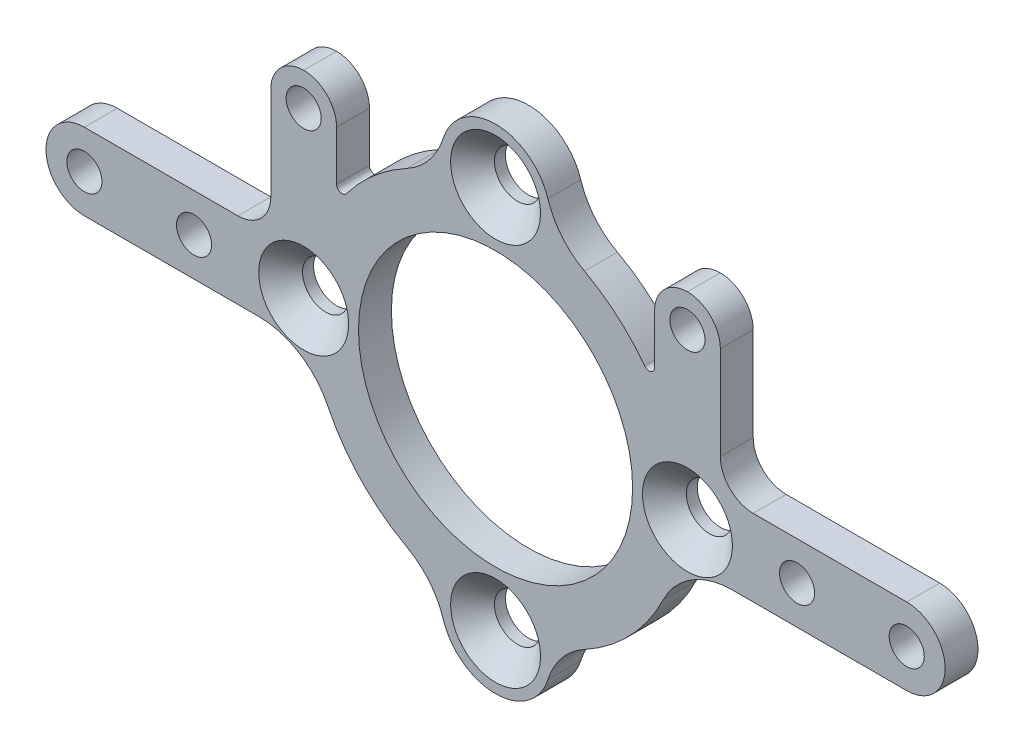
from build123d import *

# Parameters (mm, degrees)
SKETCH_1_R      = 12.5
SKETCH_1_R_2    = 2.1
SKETCH_1_R_3    = 1.6
EXTRUDE_1_DEPTH = 3
FILLET_2_R      = 7
FILLET_3_R      = 3
FILLET_4_R      = 0.5
CHAMFER_1_SIZE  = 2


with BuildPart() as part:
    # ｽｹｯﾁ1 → ﾎﾞｽ - 押し出し1 (new body)
    with BuildSketch(Plane.XY):
        with BuildLine():
            Line((-37.5, -3.5), (-16.63580476, -3.5))
            ThreePointArc((-16.63580476, -3.5), (-12.503868825, -11.517519889), (-4.852092963, -16.292857143))
            ThreePointArc((-4.852092963, -16.292857143), (0, -22.5), (4.852092963, -16.292857143))
            ThreePointArc((4.852092963, -16.292857143), (12.503868825, -11.517519889), (16.63580476, -3.5))
            Line((16.63580476, -3.5), (37.5, -3.5))
            ThreePointArc((37.5, -3.5), (41, 0), (37.5, 3.5))
            Line((37.5, 3.5), (20.5, 3.5))
            Line((20.5, 3.5), (20.5, 18))
            Line((20.5, 18), (14.5, 18))
            Line((14.5, 18), (14.5, 8.874119675))
            ThreePointArc((14.5, 8.874119675), (10.362687485, 13.476450129), (4.852092963, 16.292857143))
            ThreePointArc((4.852092963, 16.292857143), (0, 22.5), (-4.852092963, 16.292857143))
            ThreePointArc((-4.852092963, 16.292857143), (-10.362687485, 13.476450129), (-14.5, 8.874119675))
            Line((-14.5, 8.874119675), (-14.5, 18))
            Line((-14.5, 18), (-20.5, 18))
            Line((-20.5, 18), (-20.5, 3.5))
            Line((-20.5, 3.5), (-37.5, 3.5))
            ThreePointArc((-37.5, 3.5), (-41, 0), (-37.5, -3.5))
        make_face()
        Circle(SKETCH_1_R, mode=Mode.SUBTRACT)
        with Locations((0, 17.5)):
            Circle(SKETCH_1_R_2, mode=Mode.SUBTRACT)
        with Locations((-17.5, 0)):
            Circle(SKETCH_1_R_2, mode=Mode.SUBTRACT)
        with Locations((0, -17.5)):
            Circle(SKETCH_1_R_2, mode=Mode.SUBTRACT)
        with Locations((17.5, 0)):
            Circle(SKETCH_1_R_2, mode=Mode.SUBTRACT)
        with Locations((-27.5, 0)):
            Circle(SKETCH_1_R_3, mode=Mode.SUBTRACT)
        with Locations((-37.5, 0)):
            Circle(SKETCH_1_R_3, mode=Mode.SUBTRACT)
        with Locations((27.5, 0)):
            Circle(SKETCH_1_R_3, mode=Mode.SUBTRACT)
        with Locations((37.5, 0)):
            Circle(SKETCH_1_R_3, mode=Mode.SUBTRACT)
        with Locations((-17.5, 15)):
            Circle(SKETCH_1_R_3, mode=Mode.SUBTRACT)
        with Locations(Location((17.5, 15, 0), (0, 0, 180))):
            Circle(SKETCH_1_R_3, mode=Mode.SUBTRACT)
    extrude(amount=EXTRUDE_1_DEPTH)

    # ﾌｨﾚｯﾄ2
    fillet_2_edges = [part.edges().sort_by_distance(p)[0] for p in [
        (-4.852092963, 16.292857143, 1.5),
        (4.852092963, 16.292857143, 1.5),
        (16.63580476, -3.5, 1.5),
        (4.852092963, -16.292857143, 1.5),
        (-4.852092963, -16.292857143, 1.5),
        (-16.63580476, -3.5, 1.5),
    ]]
    fillet(fillet_2_edges, radius=FILLET_2_R)

    # ﾌｨﾚｯﾄ3
    fillet_3_edges = [part.edges().sort_by_distance(p)[0] for p in [
        (20.5, 18, 1.5),
        (14.5, 18, 1.5),
        (20.5, 3.5, 1.5),
        (-14.5, 18, 1.5),
        (-20.5, 18, 1.5),
        (-20.5, 3.5, 1.5),
    ]]
    fillet(fillet_3_edges, radius=FILLET_3_R - 0.0001)  # a hair under: the kernel refuses the full size

    # ﾌｨﾚｯﾄ4
    fillet_4_edges = [part.edges().sort_by_distance(p)[0] for p in [
        (14.5, 8.874119675, 1.5),
        (-14.5, 8.874119675, 1.5),
    ]]
    fillet(fillet_4_edges, radius=FILLET_4_R)

    # 面取り1
    chamfer_1_edges = [part.edges().sort_by_distance(p)[0] for p in [
        (-2.1, 17.5, 3),
        (-19.6, 0, 3),
        (-2.1, -17.5, 3),
        (15.4, 0, 3),
    ]]
    chamfer(chamfer_1_edges, length=CHAMFER_1_SIZE)


solid = part.part
